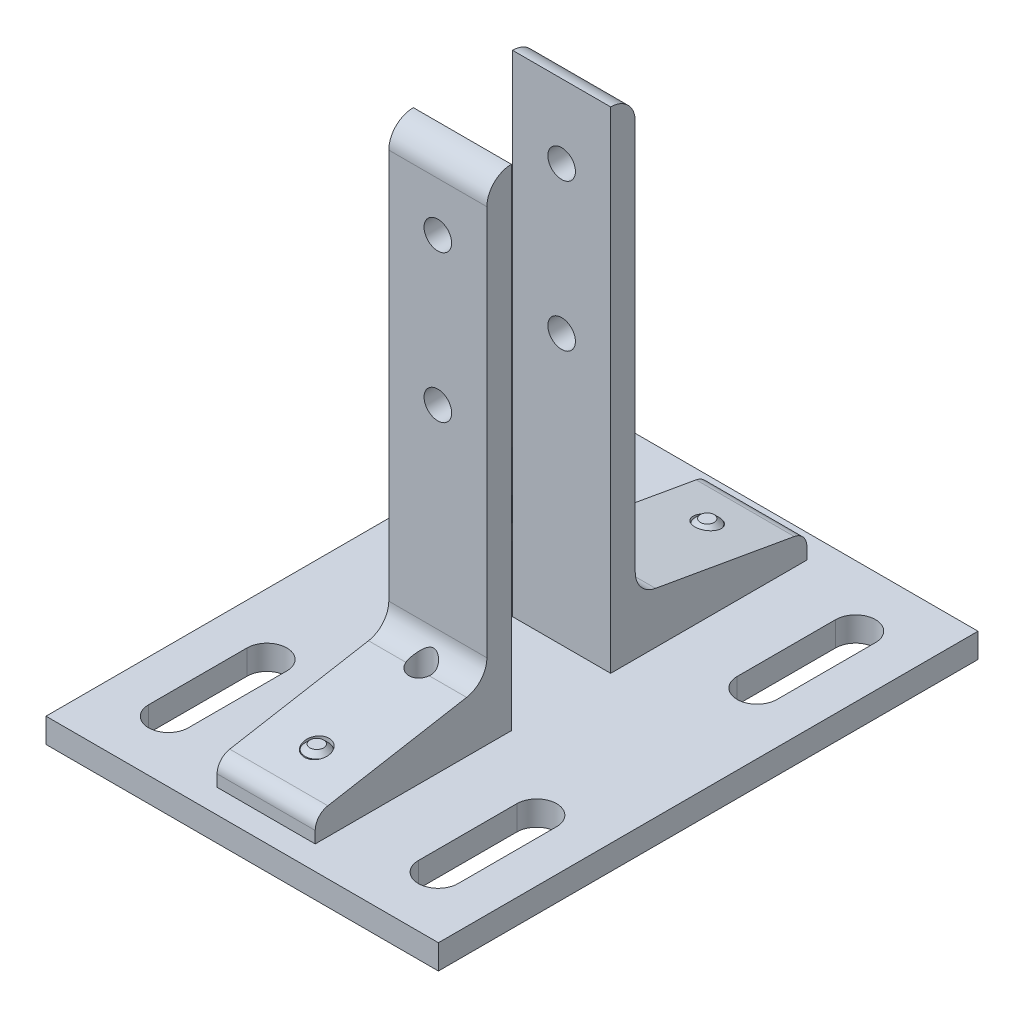
from build123d import *

# Parameters (mm, degrees)
SKETCH1_W               = 101.6
SKETCH1_H               = 139.7
BOSS_EXTRUDE1_DEPTH     = 6.35
BOSS_EXTRUDE2_DEPTH     = 12.7
FILLET1_R               = 6.35
SKETCH3_R               = 3.175
CUT_EXTRUDE1_DEPTH      = 159.876949241
SKETCH4_R               = 6.7437
CUT_EXTRUDE2_DEPTH      = 3.175
SKETCH5_R               = 3.048
BOSS_EXTRUDE4_DEPTH     = 15.875
BOSS_EXTRUDE4_2_DEPTH   = 15.875
BOSS_EXTRUDE4_3_DEPTH   = 15.875
BOSS_EXTRUDE4_4_DEPTH   = 15.875
SKETCH6_R               = 6.6167
BOSS_EXTRUDE5_DEPTH     = 3.175
CUT_EXTRUDE3_DEPTH      = 2.54
CUT_EXTRUDE4_DEPTH      = 154.586010105
CUT_EXTRUDE4_DEPTH_BACK = 154.586010105
SKETCH8_R               = 3.5687
CHAMFER1_SIZE           = 1.27


with BuildPart() as part:
    # Sketch1 → Boss-Extrude1 (new body)
    with BuildSketch(Plane(origin=(0, 0, 0), x_dir=(1, 0, 0), z_dir=(0, 1, 0))):
        Rectangle(SKETCH1_W, SKETCH1_H)
        with BuildLine():
            Line((-40.0812, 28.5242), (-40.0812, 54.0258))
            ThreePointArc((-40.0812, 54.0258), (-34.925, 59.182), (-29.7688, 54.0258))
            Line((-29.7688, 54.0258), (-29.7688, 28.5242))
            ThreePointArc((-29.7688, 28.5242), (-34.925, 23.368), (-40.0812, 28.5242))
        make_face(mode=Mode.SUBTRACT)
        with BuildLine():
            Line((-40.0812, -54.0258), (-40.0812, -28.5242))
            ThreePointArc((-40.0812, -28.5242), (-34.925, -23.368), (-29.7688, -28.5242))
            Line((-29.7688, -28.5242), (-29.7688, -54.0258))
            ThreePointArc((-29.7688, -54.0258), (-34.925, -59.182), (-40.0812, -54.0258))
        make_face(mode=Mode.SUBTRACT)
        with BuildLine():
            Line((29.7688, -54.0258), (29.7688, -28.5242))
            ThreePointArc((29.7688, -28.5242), (34.925, -23.368), (40.0812, -28.5242))
            Line((40.0812, -28.5242), (40.0812, -54.0258))
            ThreePointArc((40.0812, -54.0258), (34.925, -59.182), (29.7688, -54.0258))
        make_face(mode=Mode.SUBTRACT)
        with BuildLine():
            Line((29.7688, 28.5242), (29.7688, 54.0258))
            ThreePointArc((29.7688, 54.0258), (34.925, 59.182), (40.0812, 54.0258))
            Line((40.0812, 54.0258), (40.0812, 28.5242))
            ThreePointArc((40.0812, 28.5242), (34.925, 23.368), (29.7688, 28.5242))
        make_face(mode=Mode.SUBTRACT)
    extrude(amount=-BOSS_EXTRUDE1_DEPTH)

    # Sketch2 → Boss-Extrude2 (add, symmetric)
    with BuildSketch(Plane(origin=(0, 0, 0), x_dir=(0, 0, -1), z_dir=(1, 0, 0))):
        with BuildLine():
            Line((63.6524, 0), (63.6524, 3.0226))
            ThreePointArc((63.6524, 3.0226), (62.725374501, 5.569581625), (60.378063539, 6.924802241))
            Line((60.378063539, 6.924802241), (19.2024, 14.185182671))
            Line((19.2024, 14.185182671), (19.2024, 127))
            Line((19.2024, 127), (12.8524, 127))
            Line((12.8524, 127), (12.8524, 0))
            Line((12.8524, 0), (63.6524, 0))
        make_face()
        with BuildLine():
            Line((-12.8524, 0), (-63.6524, 0))
            Line((-63.6524, 0), (-63.6524, 3.0226))
            ThreePointArc((-63.6524, 3.0226), (-62.725374501, 5.569581625), (-60.378063539, 6.924802241))
            Line((-60.378063539, 6.924802241), (-19.2024, 14.185182671))
            Line((-19.2024, 14.185182671), (-19.2024, 127))
            Line((-19.2024, 127), (-12.8524, 127))
            Line((-12.8524, 127), (-12.8524, 0))
        make_face()
    extrude(amount=BOSS_EXTRUDE2_DEPTH, both=True)

    # Fillet1
    fillet1_edges = [part.edges().sort_by_distance(p)[0] for p in [
        (0, 14.185182671, 19.2024),
        (0, 127, 19.2024),
        (0, 14.185182671, -19.2024),
        (0, 127, -19.2024),
    ]]
    fillet(fillet1_edges, radius=FILLET1_R - 0.0001)  # a hair under: the kernel refuses the full size

    # Sketch3 → Cut-Extrude1 (cut, through all)
    with BuildSketch(Plane.XZ.offset(6.35)):
        with Locations(Location((0, 50.546, 0), (0, 0, 270))):
            Circle(SKETCH3_R)
        with Locations(Location((0, 23.495, 0), (0, 0, 270))):
            Circle(SKETCH3_R)
        with Locations(Location((0, -23.495, 0), (0, 0, 270))):
            Circle(SKETCH3_R)
        with Locations(Location((0, -50.546, 0), (0, 0, 270))):
            Circle(SKETCH3_R)
    extrude(amount=-CUT_EXTRUDE1_DEPTH, mode=Mode.SUBTRACT)

    # Sketch4 → Cut-Extrude2 (cut)
    with BuildSketch(Plane.XZ.offset(6.35)):
        with Locations(Location((0, 50.546, 0), (0, 0, 270))):
            Circle(SKETCH4_R)
        with Locations(Location((0, 23.495, 0), (0, 0, 270))):
            Circle(SKETCH4_R)
        with Locations(Location((0, -23.495, 0), (0, 0, 270))):
            Circle(SKETCH4_R)
        with Locations(Location((0, -50.546, 0), (0, 0, 270))):
            Circle(SKETCH4_R)
    extrude(amount=-CUT_EXTRUDE2_DEPTH, mode=Mode.SUBTRACT)



with BuildPart() as body_2:
    # Sketch5 → Boss-Extrude4 (new body)
    with BuildSketch(Plane.XZ.offset(6.35)):
        with Locations(Location((0, 50.546, 0), (0, 0, 270))):
            Circle(SKETCH5_R)
    extrude(amount=-BOSS_EXTRUDE4_DEPTH)


with BuildPart() as body_3:
    # Sketch5 → Boss-Extrude4 2 (new body)
    with BuildSketch(Plane.XZ.offset(6.35)):
        with Locations(Location((0, 23.495, 0), (0, 0, 270))):
            Circle(SKETCH5_R)
    extrude(amount=-BOSS_EXTRUDE4_2_DEPTH)


with BuildPart() as body_4:
    # Sketch5 → Boss-Extrude4 3 (new body)
    with BuildSketch(Plane.XZ.offset(6.35)):
        with Locations(Location((0, -23.495, 0), (0, 0, 270))):
            Circle(SKETCH5_R)
    extrude(amount=-BOSS_EXTRUDE4_3_DEPTH)


with BuildPart() as body_5:
    # Sketch5 → Boss-Extrude4 4 (new body)
    with BuildSketch(Plane.XZ.offset(6.35)):
        with Locations(Location((0, -50.546, 0), (0, 0, 270))):
            Circle(SKETCH5_R)
    extrude(amount=-BOSS_EXTRUDE4_4_DEPTH)


with BuildPart() as part_1:
    add(part.part)

    add(body_2.part)  # Boss-Extrude5 merges body 2

    add(body_3.part)  # Boss-Extrude5 merges body 3

    add(body_4.part)  # Boss-Extrude5 merges body 4

    add(body_5.part)  # Boss-Extrude5 merges body 5
    # Sketch6 → Boss-Extrude5 (add)
    with BuildSketch(Plane.XZ.offset(6.35)):
        with Locations(Location((0, 23.495, 0), (0, 0, 270))):
            Circle(SKETCH6_R)
        with Locations(Location((0, 50.546, 0), (0, 0, 270))):
            Circle(SKETCH6_R)
        with Locations(Location((0, -23.495, 0), (0, 0, 270))):
            Circle(SKETCH6_R)
        with Locations(Location((0, -50.546, 0), (0, 0, 270))):
            Circle(SKETCH6_R)
    extrude(amount=-BOSS_EXTRUDE5_DEPTH)

    # Sketch7 → Cut-Extrude3 (cut)
    with BuildSketch(Plane.XZ.offset(6.35)):
        Polygon((0, 47.498), (2.639645431, 49.022), (2.639645431, 52.07), (0, 53.594), (-2.639645431, 52.07), (-2.639645431, 49.022), align=None)
        Polygon((0, 20.447), (2.639645431, 21.971), (2.639645431, 25.019), (0, 26.543), (-2.639645431, 25.019), (-2.639645431, 21.971), align=None)
        Polygon((0, -26.543), (2.639645431, -25.019), (2.639645431, -21.971), (0, -20.447), (-2.639645431, -21.971), (-2.639645431, -25.019), align=None)
        Polygon((0, -53.594), (2.639645431, -52.07), (2.639645431, -49.022), (0, -47.498), (-2.639645431, -49.022), (-2.639645431, -52.07), align=None)
    extrude(amount=-CUT_EXTRUDE3_DEPTH, mode=Mode.SUBTRACT)

    # Sketch8 → Cut-Extrude4 (cut, two sides: drawn at the far end of the back side and taken through both)
    with BuildSketch(Plane.XY.offset(-CUT_EXTRUDE4_DEPTH_BACK)):
        with Locations(Location((0, 69.85, 0), (0, 0, 270))):
            Circle(SKETCH8_R)
        with Locations(Location((0, 107.95, 0), (0, 0, 270))):
            Circle(SKETCH8_R)
    extrude(amount=CUT_EXTRUDE4_DEPTH + CUT_EXTRUDE4_DEPTH_BACK, mode=Mode.SUBTRACT)

    # Chamfer1
    chamfer1_edges = [part_1.edges().sort_by_distance(p)[0] for p in [
        (0, 9.525, 26.543),
        (0, 9.525, 53.594),
        (0, 9.525, -20.447),
        (0, 9.525, -47.498),
    ]]
    chamfer(chamfer1_edges, length=CHAMFER1_SIZE)


solid = part_1.part
